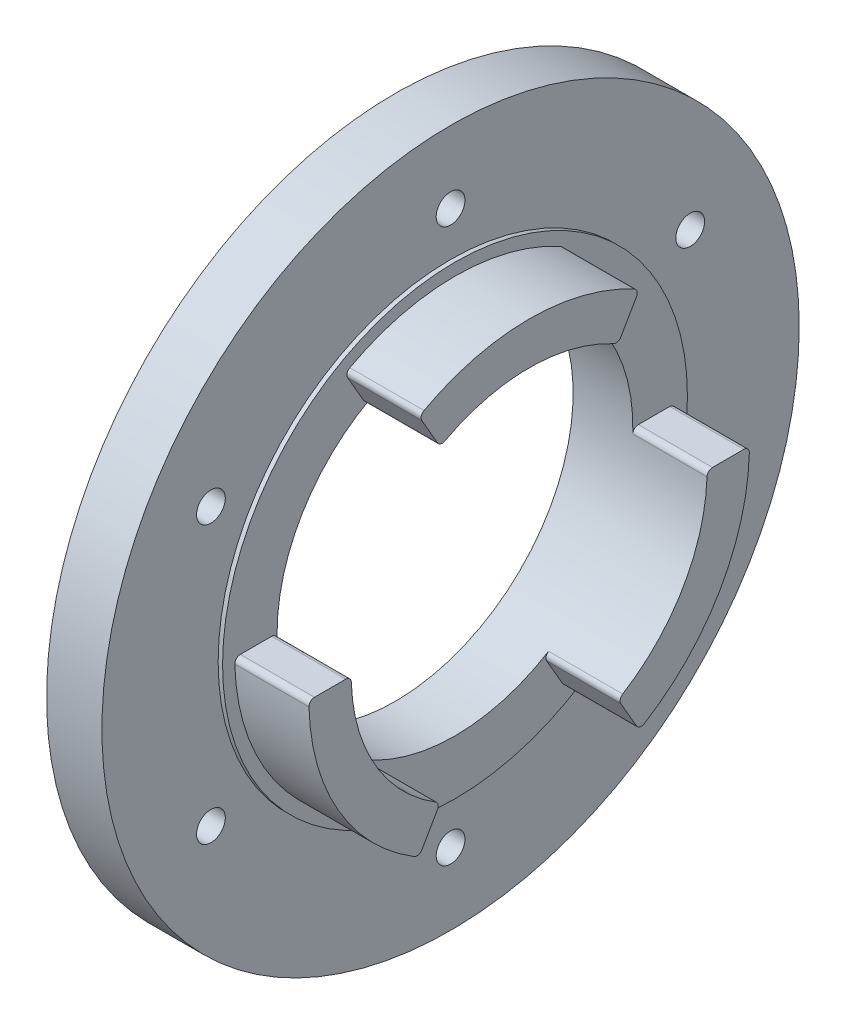
from build123d import *

# Parameters (mm, degrees)
SKIZZE2_R                        = 16.075
SCHNITT_LINEAR_AUSTRAGEN1_DEPTH  = 45.873823104344474
F_2_6_2_6_DURCHMESSER_BOHRUNG1_D = 2.6
KREISMUSTER1_COUNT               = 6
AUFSATZ_LINEAR_AUSTRAGEN1_DEPTH  = 6.7
VERRUNDUNG1_R                    = 0.5
KREISMUSTER2_START               = 5.4
KREISMUSTER2_DEPTH               = 6.7


# Read off the part's stored shape, not the designer's step: Kreismuster2
with BuildPart() as part:
    # Skizze1 → Rotation1 (revolve)
    with BuildSketch(Plane.XY, mode=Mode.PRIVATE) as rotation1_sk:
        Polygon((0, 0), (0, 31.5), (4.999999999999999, 31.5), (5.000000000000001, 20.999999999999996), (5.4, 21), (5.4, 0), align=None)
    revolve(rotation1_sk.sketch.rotate(Axis((0, 0, 0), (-1, 0, 0)), 90), axis=Axis((0, 0, 0), (-1, 0, 0)))

    # Skizze2 → Schnitt-Linear austragen1 (cut, through all)
    with BuildSketch(Plane.ZY):
        Circle(SKIZZE2_R)
    extrude(amount=-SCHNITT_LINEAR_AUSTRAGEN1_DEPTH, mode=Mode.SUBTRACT)

    # Ø2.6 (2.6) Durchmesser Bohrung1 (through all)
    with Locations(Plane(origin=(5, 0, 0), x_dir=(0, 0, -1), z_dir=(1, 0, 0))):
        with Locations((0, 25)):
            f_2_6_2_6_durchmesser_bohrung1 = Hole(F_2_6_2_6_DURCHMESSER_BOHRUNG1_D / 2)

    # Kreismuster1: Ø2.6 (2.6) Durchmesser Bohrung1 ×6 about axis
    kreismuster1_axis = Axis((0, -7.2e-16, -2.984e-14), (1, 0, 0))
    for i in range(1, KREISMUSTER1_COUNT):
        add(f_2_6_2_6_durchmesser_bohrung1.rotate(kreismuster1_axis, i * 360 / KREISMUSTER1_COUNT), mode=Mode.SUBTRACT)

    # Skizze5 → Aufsatz-Linear austragen1 (add)
    with BuildSketch(Plane(origin=(5.4, 0, 0), x_dir=(0, 0, -1), z_dir=(1, 0, 0))):
        with BuildLine():
            Line((-9.950000000000019, 17.233905535310317), (-8.037500000000017, 13.921358365834841))
            ThreePointArc((-8.037500000000017, 13.921358365834841), (9.8e-16, 16.075), (8.037500000000014, 13.921358365834843))
            Line((8.037500000000014, 13.921358365834843), (9.950000000000017, 17.233905535310317))
            ThreePointArc((9.950000000000017, 17.233905535310317), (1.22e-15, 19.9), (-9.950000000000019, 17.233905535310317))
        make_face()
    extrude(amount=AUFSATZ_LINEAR_AUSTRAGEN1_DEPTH)

    # Verrundung1
    verrundung1_edges = [part.edges().sort_by_distance(p)[0] for p in [
        (8.75, 17.233905535310317, -9.950000000000015),
        (8.75, 17.23390553531032, 9.950000000000017),
        (8.75, 13.921358365834843, 8.03750000000002),
        (8.75, 13.921358365834845, -8.037500000000014),
    ]]
    fillet(verrundung1_edges, radius=VERRUNDUNG1_R)

    # Kreismuster2 outline → Kreismuster2 (add)
    with BuildSketch(Plane.YZ.offset(KREISMUSTER2_START)):
        with BuildLine():
            ThreePointArc((-13.672564308, 8.453792655), (-8.0375, 13.921358366), (-0.484917044, 16.067684353))
            ThreePointArc((-0.484917044, 16.067684353), (-0.1411536, 16.219276879), (0, 16.567456805))
            Line((0, 16.567456805), (0, 19.393555631))
            ThreePointArc((0, 19.393555631), (-0.151032451, 19.751636138), (-0.512886598, 19.893389539))
            ThreePointArc((-0.512886598, 19.893389539), (-9.95, 17.233905535), (-16.971737409, 10.390867592))
            ThreePointArc((-16.971737409, 10.390867592), (-17.029902436, 10.006616008), (-16.795311846, 9.696777815))
            Line((-16.795311846, 9.696777815), (-14.34783847, 8.283728403))
            ThreePointArc((-14.34783847, 8.283728403), (-13.975729009, 8.231881043), (-13.672564308, 8.453792655))
        make_face()
        with BuildLine():
            ThreePointArc((0, -16.567456805), (-0.1411536, -16.219276879), (-0.484917044, -16.067684353))
            ThreePointArc((-0.484917044, -16.067684353), (-8.0375, -13.921358366), (-13.672564308, -8.453792655))
            ThreePointArc((-13.672564308, -8.453792655), (-13.975729009, -8.231881043), (-14.34783847, -8.283728403))
            Line((-14.34783847, -8.283728403), (-16.795311846, -9.696777815))
            ThreePointArc((-16.795311846, -9.696777815), (-17.029902436, -10.006616008), (-16.971737409, -10.390867592))
            ThreePointArc((-16.971737409, -10.390867592), (-9.95, -17.233905535), (-0.512886598, -19.893389539))
            ThreePointArc((-0.512886598, -19.893389539), (-0.151032451, -19.751636138), (0, -19.393555631))
            Line((0, -19.393555631), (0, -16.567456805))
        make_face()
    extrude(amount=KREISMUSTER2_DEPTH)


solid = part.part
